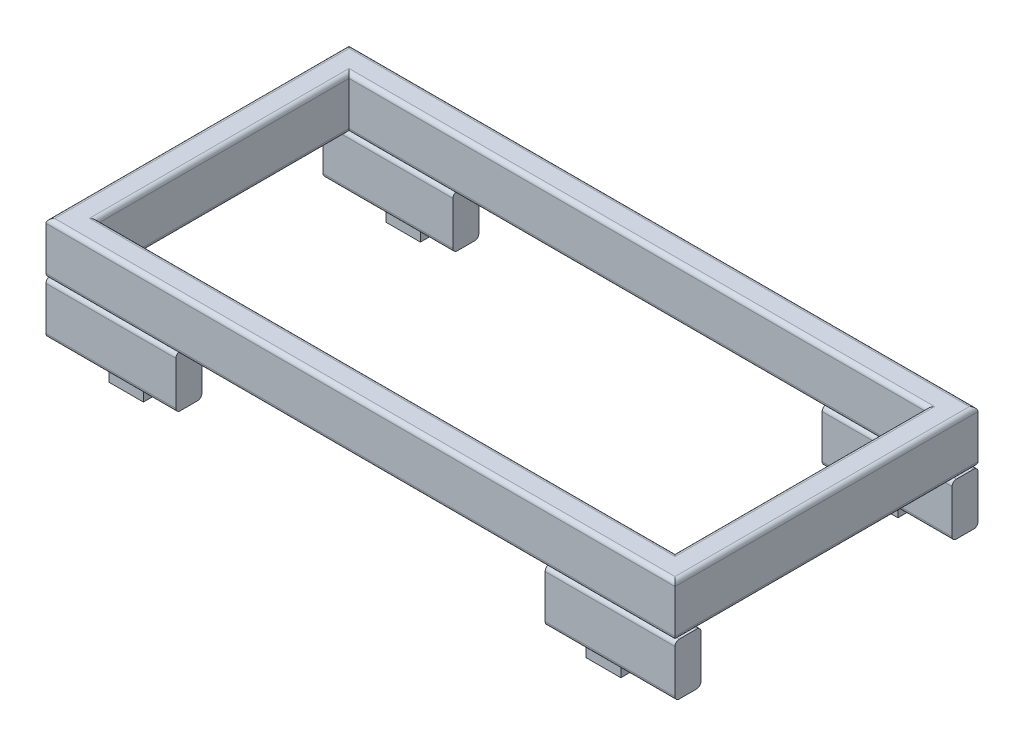
from build123d import *

# Parameters (mm, degrees)
SKIZZE1_W                       = 1453
SKIZZE1_H                       = 700
SKIZZE1_W_2                     = 1333
SKIZZE1_H_2                     = 580
AUFSATZ_LINEAR_AUSTRAGEN1_DEPTH = 60
VERRUNDUNG1_R                   = 10
SKIZZE2_W                       = 300
SKIZZE2_H                       = 60
AUFSATZ_LINEAR_AUSTRAGEN2_DEPTH = 120
VERRUNDUNG3_R                   = 10
VERRUNDUNG4_R                   = 10
SKIZZE3_R                       = 8.75
SCHNITT_LINEAR_AUSTRAGEN1_DEPTH = 120
SKIZZE4_W                       = 80
SKIZZE4_H                       = 40
AUFSATZ_LINEAR_AUSTRAGEN3_DEPTH = 25


with BuildPart() as part:
    # Skizze1 → Aufsatz-Linear austragen1 (new, symmetric)
    with BuildSketch(Plane(origin=(0, 0, 0), x_dir=(1, 0, 0), z_dir=(0, 1, 0))):
        Rectangle(SKIZZE1_W, SKIZZE1_H)
        Rectangle(SKIZZE1_W_2, SKIZZE1_H_2, mode=Mode.SUBTRACT)
    extrude(amount=AUFSATZ_LINEAR_AUSTRAGEN1_DEPTH, both=True)

    # Verrundung1
    verrundung1_edges = [part.edges().sort_by_distance(p)[0] for p in [
        (726.5, 60, 0),
        (0, 60, -350),
        (-666.5, -60, 0),
        (0, -60, 290),
        (666.5, -60, 0),
        (0, -60, -290),
        (-666.5, 60, 0),
        (0, 60, 290),
        (666.5, 60, 0),
        (0, 60, -290),
        (-726.5, 60, 0),
        (0, -60, -350),
        (726.5, -60, 0),
        (0, -60, 350),
        (-726.5, -60, 0),
        (0, 60, 350),
    ]]
    fillet(verrundung1_edges, radius=VERRUNDUNG1_R)

    # Skizze2 → Aufsatz-Linear austragen2 (add)
    with BuildSketch(Plane.XZ.offset(60)):
        with Locations((-576.5, 320)):
            Rectangle(SKIZZE2_W, SKIZZE2_H)
        with Locations((576.5, 320)):
            Rectangle(SKIZZE2_W, SKIZZE2_H)
        with Locations((576.5, -320)):
            Rectangle(SKIZZE2_W, SKIZZE2_H)
        with Locations((-576.5, -320)):
            Rectangle(SKIZZE2_W, SKIZZE2_H)
    extrude(amount=AUFSATZ_LINEAR_AUSTRAGEN2_DEPTH)

    # Verrundung3
    verrundung3_edges = [part.edges().sort_by_distance(p)[0] for p in [
        (576.5, -180, 290),
        (576.5, -180, -290),
        (576.5, -180, -350),
        (-576.5, -180, -350),
        (-576.5, -180, -290),
        (-576.5, -180, 290),
        (-576.5, -180, 350),
        (576.5, -180, 350),
    ]]
    fillet(verrundung3_edges, radius=VERRUNDUNG3_R)

    # Verrundung4
    # the kernel refuses this fillet: 10 mm, written as the material it adds along each edge
    # the kernel refuses this fillet: 10 mm, written as the material it takes off along each edge
    with BuildSketch(Plane(origin=(691.5, -60, -290), x_dir=(0, 0, -1), z_dir=(1, 0, 0)), Plane(origin=(-691.5, -60, -290), x_dir=(0, -1, 0), z_dir=(-1, 0, 0))) as verrundung4_2_piece_1:
        with BuildLine():
            CenterArc((VERRUNDUNG4_R, -VERRUNDUNG4_R), VERRUNDUNG4_R, 90, 90)
            Line((0, -VERRUNDUNG4_R), (0, 0))
            Line((0, 0), (VERRUNDUNG4_R, 0))
        make_face()
    extrude(amount=60, mode=Mode.SUBTRACT)
    with BuildSketch(Plane(origin=(401.5, -60, -290), x_dir=(0, 0, -1), z_dir=(1, 0, 0)), Plane(origin=(-401.5, -60, -290), x_dir=(0, -1, 0), z_dir=(-1, 0, 0))) as verrundung4_2_piece_2:
        with BuildLine():
            CenterArc((VERRUNDUNG4_R, -VERRUNDUNG4_R), VERRUNDUNG4_R, 90, 90)
            Line((0, -VERRUNDUNG4_R), (0, 0))
            Line((0, 0), (VERRUNDUNG4_R, 0))
        make_face()
    extrude(amount=300, mode=Mode.SUBTRACT)
    with BuildSketch(Plane(origin=(751.5, -60, -350), x_dir=(0, 0, 1), z_dir=(-1, 0, 0)), Plane(origin=(-751.5, -60, 350), x_dir=(0, 0, -1), z_dir=(1, 0, 0))) as verrundung4_2_piece_3:
        with BuildLine():
            CenterArc((VERRUNDUNG4_R, -VERRUNDUNG4_R), VERRUNDUNG4_R, 90, 90)
            Line((0, -VERRUNDUNG4_R), (0, 0))
            Line((0, 0), (VERRUNDUNG4_R, 0))
        make_face()
    extrude(amount=350, mode=Mode.SUBTRACT)
    with BuildSketch(Plane(origin=(-751.5, -60, -350), x_dir=(0, 0, 1), z_dir=(1, 0, 0)), Plane(origin=(751.5, -60, 350), x_dir=(0, 0, -1), z_dir=(-1, 0, 0))) as verrundung4_2_piece_4:
        with BuildLine():
            CenterArc((VERRUNDUNG4_R, VERRUNDUNG4_R), VERRUNDUNG4_R, 180, 90)
            Line((0, VERRUNDUNG4_R), (0, 0))
            Line((0, 0), (VERRUNDUNG4_R, 0))
        make_face()
    extrude(amount=350, mode=Mode.SUBTRACT)
    with BuildSketch(Plane(origin=(-691.5, -60, 290), x_dir=(0, -1, 0), z_dir=(-1, 0, 0)), Plane(origin=(691.5, -60, 290), x_dir=(0, 0, 1), z_dir=(1, 0, 0))) as verrundung4_2_piece_5:
        with BuildLine():
            CenterArc((VERRUNDUNG4_R, VERRUNDUNG4_R), VERRUNDUNG4_R, 180, 90)
            Line((0, VERRUNDUNG4_R), (0, 0))
            Line((0, 0), (VERRUNDUNG4_R, 0))
        make_face()
    extrude(amount=60, mode=Mode.SUBTRACT)
    with BuildSketch(Plane(origin=(-401.5, -60, 290), x_dir=(0, -1, 0), z_dir=(-1, 0, 0)), Plane(origin=(401.5, -60, 290), x_dir=(0, 0, 1), z_dir=(1, 0, 0))) as verrundung4_2_piece_6:
        with BuildLine():
            CenterArc((VERRUNDUNG4_R, VERRUNDUNG4_R), VERRUNDUNG4_R, 180, 90)
            Line((0, VERRUNDUNG4_R), (0, 0))
            Line((0, 0), (VERRUNDUNG4_R, 0))
        make_face()
    extrude(amount=300, mode=Mode.SUBTRACT)

    # Skizze3 → Schnitt-Linear austragen1 (cut)
    with BuildSketch(Plane.XZ.offset(180)):
        with Locations(Location((-619.5, 320, 0), (0, 0, 270))):
            Circle(SKIZZE3_R)
        with Locations(Location((-619.5, -320, 0), (0, 0, 270))):
            Circle(SKIZZE3_R)
        with Locations(Location((619.5, 320, 0), (0, 0, 270))):
            Circle(SKIZZE3_R)
        with Locations(Location((619.5, -320, 0), (0, 0, 270))):
            Circle(SKIZZE3_R)
    extrude(amount=-SCHNITT_LINEAR_AUSTRAGEN1_DEPTH, mode=Mode.SUBTRACT)

    # Skizze4 → Aufsatz-Linear austragen3 (add)
    with BuildSketch(Plane.XZ.offset(180)):
        with Locations((-551.5, 320)):
            Rectangle(SKIZZE4_W, SKIZZE4_H)
        with Locations((551.5, 320)):
            Rectangle(SKIZZE4_W, SKIZZE4_H)
        with Locations((551.5, -320)):
            Rectangle(SKIZZE4_W, SKIZZE4_H)
        with Locations((-551.5, -320)):
            Rectangle(SKIZZE4_W, SKIZZE4_H)
    extrude(amount=AUFSATZ_LINEAR_AUSTRAGEN3_DEPTH)


solid = part.part
